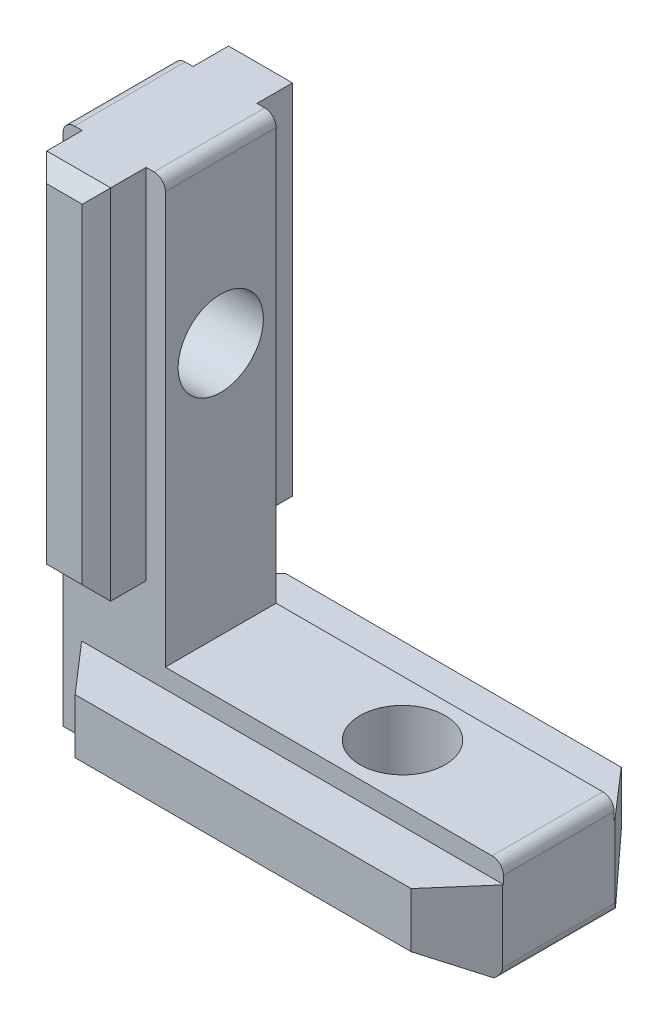
from build123d import *

# Parameters (mm, degrees)
EXTRUDE1_DEPTH      = 3.9
EXTRUDE1_DEPTH_BACK = 3.9
SKETCH2_W           = 4.5
SKETCH2_H           = 25.2
SKETCH2_W_2         = 29.65
SKETCH2_H_2         = 5.85
EXTRUDE2_DEPTH      = 3.5
CHAMFER1_SIZE       = 3
CHAMFER1_SIZE2      = 3.451105222
CHAMFER2_SIZE       = 2
CHAMFER2_SIZE2      = 3.464101615
CHAMFER3_SIZE       = 1
EXTRUDE3_REACH      = 40.849
SKETCH4_R           = 3
FILLET1_R           = 0.8
EXTRUDE4_REACH      = 40.849
SKETCH5_R           = 3


# Read off the part's stored shape, not the designer's step: Mirror1
with BuildPart() as part:
    # Sketch1 → Extrude1 (new, two sides: drawn at the far end of the back side and taken through both)
    with BuildSketch(Plane.XY.offset(-EXTRUDE1_DEPTH_BACK)):
        Polygon((0, 0), (0, 29.8), (-7.2, 29.8), (-7.2, -7.2), (23.8, -7.2), (23.8, 0), align=None)
    extrude(amount=EXTRUDE1_DEPTH + EXTRUDE1_DEPTH_BACK)

    # Sketch2 → Extrude2 (add)
    with BuildSketch(Plane.XY.offset(3.9)):
        with Locations((-3.6, 17.2)):
            Rectangle(SKETCH2_W, SKETCH2_H)
        with Locations((8.975, -4.275)):
            Rectangle(SKETCH2_W_2, SKETCH2_H_2)
    extrude(amount=EXTRUDE2_DEPTH)

    # Chamfer1
    chamfer1_edges = [part.edges().sort_by_distance(p)[0] for p in [
        (23.8, -4.275, 7.4),
        (-5.85, -4.275, 7.4),
    ]]
    chamfer1_side = [part.faces().sort_by_distance(p)[0] for p in [
        (8.975, -4.275, 7.4),
    ]]
    chamfer(chamfer1_edges, length=CHAMFER1_SIZE, length2=CHAMFER1_SIZE2, reference=chamfer1_side[0])

    # Chamfer2
    chamfer2_edges = [part.edges().sort_by_distance(p)[0] for p in [
        (8.975, -7.2, 7.4),
    ]]
    chamfer2_side = [part.faces().sort_by_distance(p)[0] for p in [
        (8.975, -4.275, 7.4),
    ]]
    chamfer(chamfer2_edges, length=CHAMFER2_SIZE, length2=CHAMFER2_SIZE2, reference=chamfer2_side[0])

    # Chamfer3
    chamfer3_edges = [part.edges().sort_by_distance(p)[0] for p in [
        (-3.6, 29.8, 7.4),
        (-1.35, 17.2, 7.4),
        (-3.6, 4.6, 7.4),
        (-5.85, 17.2, 7.4),
    ]]
    chamfer(chamfer3_edges, length=CHAMFER3_SIZE)

    # Mirror1: part across plane


with BuildPart() as part_1:
    add(part.part)
    add(part.part.mirror(Plane.XY))

    # Sketch4 → Extrude3 (cut, up to next)
    with BuildSketch(Plane(origin=(0, 0, 0), x_dir=(1, 0, 0), z_dir=(0, 1, 0)), mode=Mode.PRIVATE) as extrude3_sk1:
        with Locations(Location((12.8, 0, 0), (0, 0, 270))):
            Circle(SKETCH4_R)
    extrude3_tool1 = extrude(extrude3_sk1.sketch, amount=-EXTRUDE3_REACH, mode=Mode.PRIVATE) & part_1.part
    add(extrude3_tool1.solids().sort_by_distance((12.8, 0, 0))[0], mode=Mode.SUBTRACT)

    # Fillet1
    fillet1_edges = [part_1.edges().sort_by_distance(p)[0] for p in [
        (-7.2, 29.8, 0),
        (23.8, -7.2, 0),
        (23.8, 0, 0),
        (0, 29.8, 0),
    ]]
    fillet(fillet1_edges, radius=FILLET1_R)

    # Sketch5 → Extrude4 (cut, up to next)
    with BuildSketch(Plane(origin=(0, 0, 0), x_dir=(0, 0, -1), z_dir=(1, 0, 0)), mode=Mode.PRIVATE) as extrude4_sk1:
        with Locations(Location((0, 17.8, 0), (0, 0, 90))):
            Circle(SKETCH5_R)
    extrude4_tool1 = extrude(extrude4_sk1.sketch, amount=-EXTRUDE4_REACH, mode=Mode.PRIVATE) & part_1.part
    add(extrude4_tool1.solids().sort_by_distance((0, 17.8, 0))[0], mode=Mode.SUBTRACT)


solid = part_1.part
